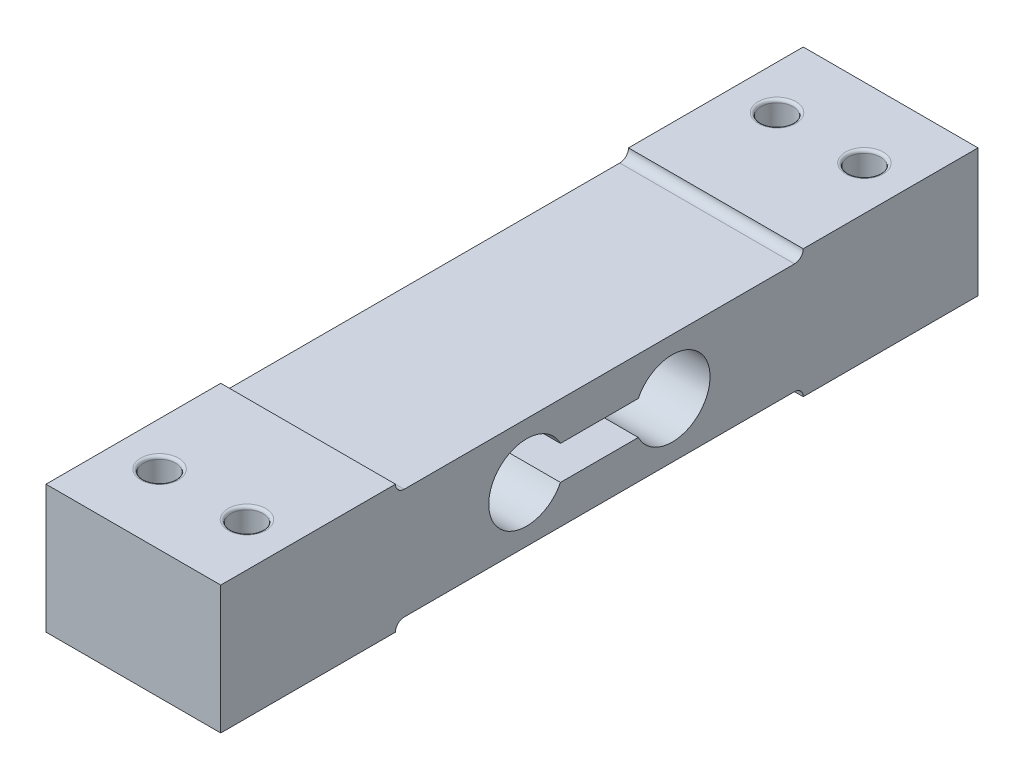
from build123d import *

# Parameters (mm, degrees)
BOSS_EXTRUDE1_DEPTH     = 30
FILLET1_R               = 1.5
SKETCH2_R               = 2.75
CUT_EXTRUDE1_DEPTH      = 75.893257373
MIRROR2_COPY_1_SKETCH_R = 2.75
MIRROR2_COPY_1_DEPTH    = 75.893257373
FILLET2_R               = 0.5


with BuildPart() as part:
    # Sketch1 → Boss-Extrude1 (new body)
    with BuildSketch(Plane(origin=(0, 0, 0), x_dir=(0, 0, -1), z_dir=(1, 0, 0))):
        Polygon((-35, 11), (-65, 11), (-65, -11), (-35, -11), (-35, -9.5), (35, -9.5), (35, -11), (65, -11), (65, 11), (35, 11), (35, 9.5), (-35, 9.5), align=None)
        with BuildLine():
            Line((-6.682784171, 2.9), (6.682784171, 2.9))
            ThreePointArc((6.682784171, 2.9), (19, 0), (6.682784171, -2.9))
            Line((6.682784171, -2.9), (-6.682784171, -2.9))
            ThreePointArc((-6.682784171, -2.9), (-19, 0), (-6.682784171, 2.9))
        make_face(mode=Mode.SUBTRACT)
    extrude(amount=BOSS_EXTRUDE1_DEPTH)

    # Fillet1
    fillet1_edges = [part.edges().sort_by_distance(p)[0] for p in [
        (15, -9.5, 35),
        (15, -9.5, -35),
        (15, 9.5, -35),
        (15, 9.5, 35),
    ]]
    fillet(fillet1_edges, radius=FILLET1_R - 0.0001)  # a hair under: the kernel refuses the full size

    # Sketch2 → Cut-Extrude1 (cut, through all)
    with BuildSketch(Plane(origin=(0, 11, 0), x_dir=(1, 0, 0), z_dir=(0, 1, 0))):
        with Locations(Location((7.5, 53, 0), (0, 0, 270))):
            Circle(SKETCH2_R)
    cut_extrude1 = extrude(amount=-CUT_EXTRUDE1_DEPTH, mode=Mode.SUBTRACT)

    # Mirror1: Cut-Extrude1 across plane
    add(cut_extrude1.mirror(Plane(origin=(15, 0, 0), x_dir=(0, 0, 1), z_dir=(1, 0, 0))), mode=Mode.SUBTRACT)

    # Mirror2: Cut-Extrude1 across plane
    add(cut_extrude1.mirror(Plane.XY), mode=Mode.SUBTRACT)

    # Mirror2 copy 1 sketch → Mirror2 copy 1 (cut, through all)
    with BuildSketch(Plane(origin=(30, 11, 0), x_dir=(-1, 0, 0), z_dir=(0, 1, 0))):
        with Locations(Location((7.5, 53, 0), (0, 0, 270))):
            Circle(MIRROR2_COPY_1_SKETCH_R)
    extrude(amount=-MIRROR2_COPY_1_DEPTH, mode=Mode.SUBTRACT)

    # Fillet2
    fillet2_edges = [part.edges().sort_by_distance(p)[0] for p in [
        (7.5, -11, -55.75),
        (7.5, 11, -55.75),
        (22.5, 11, -55.75),
        (22.5, -11, -55.75),
        (7.5, 11, 55.75),
        (7.5, -11, 55.75),
        (22.5, -11, 55.75),
        (22.5, 11, 55.75),
    ]]
    fillet(fillet2_edges, radius=FILLET2_R)


solid = part.part
